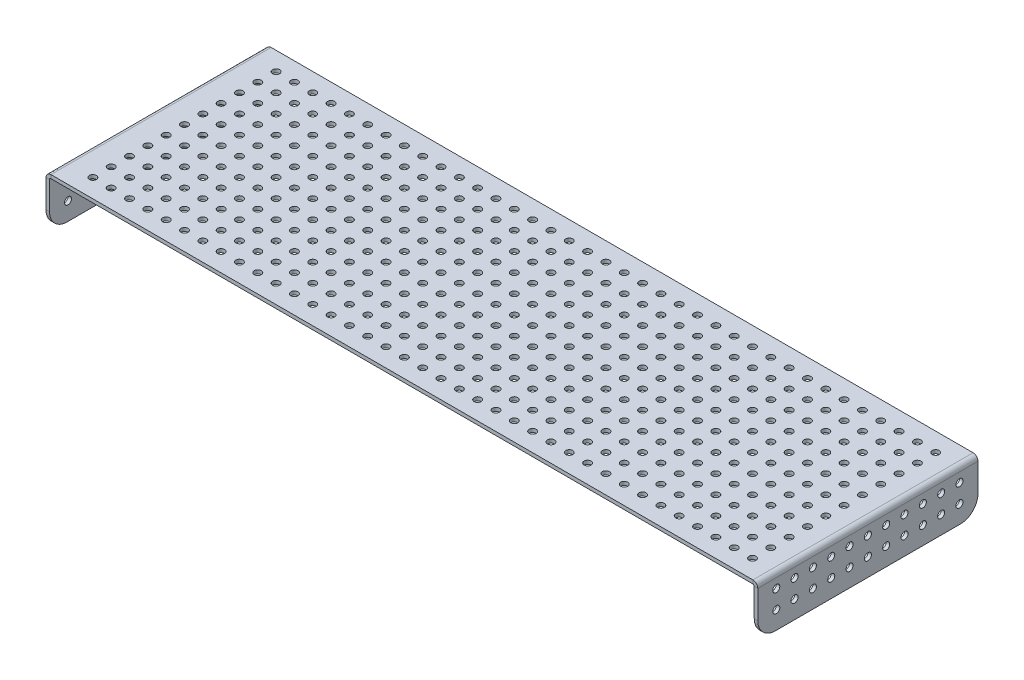
from build123d import *

# Parameters (mm, degrees)
BASE_FLANGE1_DEPTH = 119.0625
FILLET1_R          = 9.525
SKETCH8_R          = 1.905
CUT_EXTRUDE1_DEPTH = 1.905
SKETCH9_R          = 1.905
CUT_EXTRUDE2_DEPTH = 404.608442685


# Sheet-metal steps are written as plain solids
with BuildPart() as part:
    # Sketch2 → Base-Flange1 (new body)
    with BuildSketch(Plane.XY):
        with BuildLine():
            Line((-128.301113586, -25.4), (-128.301113586, -0.7366))
            ThreePointArc((-128.301113586, -0.7366), (-128.085368441, -0.215745145), (-127.564513586, 0))
            Line((-127.564513586, 0), (251.962286414, 0))
            ThreePointArc((251.962286414, 0), (252.483141269, -0.215745145), (252.698886414, -0.7366))
            Line((252.698886414, -0.7366), (252.698886414, -25.4))
            Line((252.698886414, -25.4), (254.603886414, -25.4))
            Line((254.603886414, -25.4), (254.603886414, -0.7366))
            ThreePointArc((254.603886414, -0.7366), (253.830179687, 1.131293273), (251.962286414, 1.905))
            Line((251.962286414, 1.905), (-127.564513586, 1.905))
            ThreePointArc((-127.564513586, 1.905), (-129.432406859, 1.131293273), (-130.206113586, -0.7366))
            Line((-130.206113586, -0.7366), (-130.206113586, -25.4))
            Line((-130.206113586, -25.4), (-128.301113586, -25.4))
        make_face()
    extrude(amount=-BASE_FLANGE1_DEPTH)

    # Fillet1
    fillet1_edges = [part.edges().sort_by_distance(p)[0] for p in [
        (253.651386414, -25.4, 0),
        (-129.253613586, -25.4, 0),
        (253.651386414, -25.4, -119.0625),
        (-129.253613586, -25.4, -119.0625),
    ]]
    fillet(fillet1_edges, radius=FILLET1_R)

    # Sketch8 → Cut-Extrude1 (cut)
    with BuildSketch(Plane(origin=(0, 1.905, 0), x_dir=(1, 0, 0), z_dir=(0, 1, 0))):
        with Locations(Location((-114.864513586, 10.00125, 0), (0, 0, 270))):
            Circle(SKETCH8_R)
        with Locations(Location((-104.958513586, 10.00125, 0), (0, 0, 270))):
            Circle(SKETCH8_R)
        with Locations(Location((-95.052513586, 10.00125, 0), (0, 0, 270))):
            Circle(SKETCH8_R)
        with Locations(Location((-85.146513586, 10.00125, 0), (0, 0, 270))):
            Circle(SKETCH8_R)
        with Locations(Location((-75.240513586, 10.00125, 0), (0, 0, 270))):
            Circle(SKETCH8_R)
        with Locations(Location((-65.334513586, 10.00125, 0), (0, 0, 270))):
            Circle(SKETCH8_R)
        with Locations(Location((-55.428513586, 10.00125, 0), (0, 0, 270))):
            Circle(SKETCH8_R)
        with Locations(Location((-45.522513586, 10.00125, 0), (0, 0, 270))):
            Circle(SKETCH8_R)
        with Locations(Location((-35.616513586, 10.00125, 0), (0, 0, 270))):
            Circle(SKETCH8_R)
        with Locations(Location((-25.710513586, 10.00125, 0), (0, 0, 270))):
            Circle(SKETCH8_R)
        with Locations(Location((-15.804513586, 10.00125, 0), (0, 0, 270))):
            Circle(SKETCH8_R)
        with Locations(Location((-5.898513586, 10.00125, 0), (0, 0, 270))):
            Circle(SKETCH8_R)
        with Locations(Location((4.007486414, 10.00125, 0), (0, 0, 270))):
            Circle(SKETCH8_R)
        with Locations(Location((13.913486414, 10.00125, 0), (0, 0, 270))):
            Circle(SKETCH8_R)
        with Locations(Location((23.819486414, 10.00125, 0), (0, 0, 270))):
            Circle(SKETCH8_R)
        with Locations(Location((33.725486414, 10.00125, 0), (0, 0, 270))):
            Circle(SKETCH8_R)
        with Locations(Location((43.631486414, 10.00125, 0), (0, 0, 270))):
            Circle(SKETCH8_R)
        with Locations(Location((53.537486414, 10.00125, 0), (0, 0, 270))):
            Circle(SKETCH8_R)
        with Locations(Location((63.443486414, 10.00125, 0), (0, 0, 270))):
            Circle(SKETCH8_R)
        with Locations(Location((73.349486414, 10.00125, 0), (0, 0, 270))):
            Circle(SKETCH8_R)
        with Locations(Location((83.255486414, 10.00125, 0), (0, 0, 270))):
            Circle(SKETCH8_R)
        with Locations(Location((93.161486414, 10.00125, 0), (0, 0, 270))):
            Circle(SKETCH8_R)
        with Locations(Location((103.067486414, 10.00125, 0), (0, 0, 270))):
            Circle(SKETCH8_R)
        with Locations(Location((112.973486414, 10.00125, 0), (0, 0, 270))):
            Circle(SKETCH8_R)
        with Locations(Location((122.879486414, 10.00125, 0), (0, 0, 270))):
            Circle(SKETCH8_R)
        with Locations(Location((132.785486414, 10.00125, 0), (0, 0, 270))):
            Circle(SKETCH8_R)
        with Locations(Location((142.691486414, 10.00125, 0), (0, 0, 270))):
            Circle(SKETCH8_R)
        with Locations(Location((152.597486414, 10.00125, 0), (0, 0, 270))):
            Circle(SKETCH8_R)
        with Locations(Location((162.503486414, 10.00125, 0), (0, 0, 270))):
            Circle(SKETCH8_R)
        with Locations(Location((172.409486414, 10.00125, 0), (0, 0, 270))):
            Circle(SKETCH8_R)
        with Locations(Location((182.315486414, 10.00125, 0), (0, 0, 270))):
            Circle(SKETCH8_R)
        with Locations(Location((192.221486414, 10.00125, 0), (0, 0, 270))):
            Circle(SKETCH8_R)
        with Locations(Location((202.127486414, 10.00125, 0), (0, 0, 270))):
            Circle(SKETCH8_R)
        with Locations(Location((212.033486414, 10.00125, 0), (0, 0, 270))):
            Circle(SKETCH8_R)
        with Locations(Location((221.939486414, 10.00125, 0), (0, 0, 270))):
            Circle(SKETCH8_R)
        with Locations(Location((231.845486414, 10.00125, 0), (0, 0, 270))):
            Circle(SKETCH8_R)
        with Locations(Location((241.751486414, 10.00125, 0), (0, 0, 270))):
            Circle(SKETCH8_R)
        with Locations(Location((-104.958513586, 19.90725, 0), (0, 0, 270))):
            Circle(SKETCH8_R)
        with Locations(Location((-95.052513586, 19.90725, 0), (0, 0, 270))):
            Circle(SKETCH8_R)
        with Locations(Location((-85.146513586, 19.90725, 0), (0, 0, 270))):
            Circle(SKETCH8_R)
        with Locations(Location((-75.240513586, 19.90725, 0), (0, 0, 270))):
            Circle(SKETCH8_R)
        with Locations(Location((-65.334513586, 19.90725, 0), (0, 0, 270))):
            Circle(SKETCH8_R)
        with Locations(Location((-55.428513586, 19.90725, 0), (0, 0, 270))):
            Circle(SKETCH8_R)
        with Locations(Location((-45.522513586, 19.90725, 0), (0, 0, 270))):
            Circle(SKETCH8_R)
        with Locations(Location((-35.616513586, 19.90725, 0), (0, 0, 270))):
            Circle(SKETCH8_R)
        with Locations(Location((-25.710513586, 19.90725, 0), (0, 0, 270))):
            Circle(SKETCH8_R)
        with Locations(Location((-15.804513586, 19.90725, 0), (0, 0, 270))):
            Circle(SKETCH8_R)
        with Locations(Location((-5.898513586, 19.90725, 0), (0, 0, 270))):
            Circle(SKETCH8_R)
        with Locations(Location((4.007486414, 19.90725, 0), (0, 0, 270))):
            Circle(SKETCH8_R)
        with Locations(Location((13.913486414, 19.90725, 0), (0, 0, 270))):
            Circle(SKETCH8_R)
        with Locations(Location((23.819486414, 19.90725, 0), (0, 0, 270))):
            Circle(SKETCH8_R)
        with Locations(Location((33.725486414, 19.90725, 0), (0, 0, 270))):
            Circle(SKETCH8_R)
        with Locations(Location((43.631486414, 19.90725, 0), (0, 0, 270))):
            Circle(SKETCH8_R)
        with Locations(Location((53.537486414, 19.90725, 0), (0, 0, 270))):
            Circle(SKETCH8_R)
        with Locations(Location((63.443486414, 19.90725, 0), (0, 0, 270))):
            Circle(SKETCH8_R)
        with Locations(Location((73.349486414, 19.90725, 0), (0, 0, 270))):
            Circle(SKETCH8_R)
        with Locations(Location((83.255486414, 19.90725, 0), (0, 0, 270))):
            Circle(SKETCH8_R)
        with Locations(Location((93.161486414, 19.90725, 0), (0, 0, 270))):
            Circle(SKETCH8_R)
        with Locations(Location((103.067486414, 19.90725, 0), (0, 0, 270))):
            Circle(SKETCH8_R)
        with Locations(Location((112.973486414, 19.90725, 0), (0, 0, 270))):
            Circle(SKETCH8_R)
        with Locations(Location((122.879486414, 19.90725, 0), (0, 0, 270))):
            Circle(SKETCH8_R)
        with Locations(Location((132.785486414, 19.90725, 0), (0, 0, 270))):
            Circle(SKETCH8_R)
        with Locations(Location((142.691486414, 19.90725, 0), (0, 0, 270))):
            Circle(SKETCH8_R)
        with Locations(Location((152.597486414, 19.90725, 0), (0, 0, 270))):
            Circle(SKETCH8_R)
        with Locations(Location((162.503486414, 19.90725, 0), (0, 0, 270))):
            Circle(SKETCH8_R)
        with Locations(Location((172.409486414, 19.90725, 0), (0, 0, 270))):
            Circle(SKETCH8_R)
        with Locations(Location((182.315486414, 19.90725, 0), (0, 0, 270))):
            Circle(SKETCH8_R)
        with Locations(Location((192.221486414, 19.90725, 0), (0, 0, 270))):
            Circle(SKETCH8_R)
        with Locations(Location((202.127486414, 19.90725, 0), (0, 0, 270))):
            Circle(SKETCH8_R)
        with Locations(Location((212.033486414, 19.90725, 0), (0, 0, 270))):
            Circle(SKETCH8_R)
        with Locations(Location((221.939486414, 19.90725, 0), (0, 0, 270))):
            Circle(SKETCH8_R)
        with Locations(Location((231.845486414, 19.90725, 0), (0, 0, 270))):
            Circle(SKETCH8_R)
        with Locations(Location((241.751486414, 19.90725, 0), (0, 0, 270))):
            Circle(SKETCH8_R)
        with Locations(Location((-104.958513586, 29.81325, 0), (0, 0, 270))):
            Circle(SKETCH8_R)
        with Locations(Location((-95.052513586, 29.81325, 0), (0, 0, 270))):
            Circle(SKETCH8_R)
        with Locations(Location((-85.146513586, 29.81325, 0), (0, 0, 270))):
            Circle(SKETCH8_R)
        with Locations(Location((-75.240513586, 29.81325, 0), (0, 0, 270))):
            Circle(SKETCH8_R)
        with Locations(Location((-65.334513586, 29.81325, 0), (0, 0, 270))):
            Circle(SKETCH8_R)
        with Locations(Location((-55.428513586, 29.81325, 0), (0, 0, 270))):
            Circle(SKETCH8_R)
        with Locations(Location((-45.522513586, 29.81325, 0), (0, 0, 270))):
            Circle(SKETCH8_R)
        with Locations(Location((-35.616513586, 29.81325, 0), (0, 0, 270))):
            Circle(SKETCH8_R)
        with Locations(Location((-25.710513586, 29.81325, 0), (0, 0, 270))):
            Circle(SKETCH8_R)
        with Locations(Location((-15.804513586, 29.81325, 0), (0, 0, 270))):
            Circle(SKETCH8_R)
        with Locations(Location((-5.898513586, 29.81325, 0), (0, 0, 270))):
            Circle(SKETCH8_R)
        with Locations(Location((4.007486414, 29.81325, 0), (0, 0, 270))):
            Circle(SKETCH8_R)
        with Locations(Location((13.913486414, 29.81325, 0), (0, 0, 270))):
            Circle(SKETCH8_R)
        with Locations(Location((23.819486414, 29.81325, 0), (0, 0, 270))):
            Circle(SKETCH8_R)
        with Locations(Location((33.725486414, 29.81325, 0), (0, 0, 270))):
            Circle(SKETCH8_R)
        with Locations(Location((43.631486414, 29.81325, 0), (0, 0, 270))):
            Circle(SKETCH8_R)
        with Locations(Location((53.537486414, 29.81325, 0), (0, 0, 270))):
            Circle(SKETCH8_R)
        with Locations(Location((63.443486414, 29.81325, 0), (0, 0, 270))):
            Circle(SKETCH8_R)
        with Locations(Location((73.349486414, 29.81325, 0), (0, 0, 270))):
            Circle(SKETCH8_R)
        with Locations(Location((83.255486414, 29.81325, 0), (0, 0, 270))):
            Circle(SKETCH8_R)
        with Locations(Location((93.161486414, 29.81325, 0), (0, 0, 270))):
            Circle(SKETCH8_R)
        with Locations(Location((103.067486414, 29.81325, 0), (0, 0, 270))):
            Circle(SKETCH8_R)
        with Locations(Location((112.973486414, 29.81325, 0), (0, 0, 270))):
            Circle(SKETCH8_R)
        with Locations(Location((122.879486414, 29.81325, 0), (0, 0, 270))):
            Circle(SKETCH8_R)
        with Locations(Location((132.785486414, 29.81325, 0), (0, 0, 270))):
            Circle(SKETCH8_R)
        with Locations(Location((142.691486414, 29.81325, 0), (0, 0, 270))):
            Circle(SKETCH8_R)
        with Locations(Location((152.597486414, 29.81325, 0), (0, 0, 270))):
            Circle(SKETCH8_R)
        with Locations(Location((162.503486414, 29.81325, 0), (0, 0, 270))):
            Circle(SKETCH8_R)
        with Locations(Location((172.409486414, 29.81325, 0), (0, 0, 270))):
            Circle(SKETCH8_R)
        with Locations(Location((182.315486414, 29.81325, 0), (0, 0, 270))):
            Circle(SKETCH8_R)
        with Locations(Location((192.221486414, 29.81325, 0), (0, 0, 270))):
            Circle(SKETCH8_R)
        with Locations(Location((202.127486414, 29.81325, 0), (0, 0, 270))):
            Circle(SKETCH8_R)
        with Locations(Location((212.033486414, 29.81325, 0), (0, 0, 270))):
            Circle(SKETCH8_R)
        with Locations(Location((221.939486414, 29.81325, 0), (0, 0, 270))):
            Circle(SKETCH8_R)
        with Locations(Location((231.845486414, 29.81325, 0), (0, 0, 270))):
            Circle(SKETCH8_R)
        with Locations(Location((241.751486414, 29.81325, 0), (0, 0, 270))):
            Circle(SKETCH8_R)
        with Locations(Location((-104.958513586, 39.71925, 0), (0, 0, 270))):
            Circle(SKETCH8_R)
        with Locations(Location((-95.052513586, 39.71925, 0), (0, 0, 270))):
            Circle(SKETCH8_R)
        with Locations(Location((-85.146513586, 39.71925, 0), (0, 0, 270))):
            Circle(SKETCH8_R)
        with Locations(Location((-75.240513586, 39.71925, 0), (0, 0, 270))):
            Circle(SKETCH8_R)
        with Locations(Location((-65.334513586, 39.71925, 0), (0, 0, 270))):
            Circle(SKETCH8_R)
        with Locations(Location((-55.428513586, 39.71925, 0), (0, 0, 270))):
            Circle(SKETCH8_R)
        with Locations(Location((-45.522513586, 39.71925, 0), (0, 0, 270))):
            Circle(SKETCH8_R)
        with Locations(Location((-35.616513586, 39.71925, 0), (0, 0, 270))):
            Circle(SKETCH8_R)
        with Locations(Location((-25.710513586, 39.71925, 0), (0, 0, 270))):
            Circle(SKETCH8_R)
        with Locations(Location((-15.804513586, 39.71925, 0), (0, 0, 270))):
            Circle(SKETCH8_R)
        with Locations(Location((-5.898513586, 39.71925, 0), (0, 0, 270))):
            Circle(SKETCH8_R)
        with Locations(Location((4.007486414, 39.71925, 0), (0, 0, 270))):
            Circle(SKETCH8_R)
        with Locations(Location((13.913486414, 39.71925, 0), (0, 0, 270))):
            Circle(SKETCH8_R)
        with Locations(Location((23.819486414, 39.71925, 0), (0, 0, 270))):
            Circle(SKETCH8_R)
        with Locations(Location((33.725486414, 39.71925, 0), (0, 0, 270))):
            Circle(SKETCH8_R)
        with Locations(Location((43.631486414, 39.71925, 0), (0, 0, 270))):
            Circle(SKETCH8_R)
        with Locations(Location((53.537486414, 39.71925, 0), (0, 0, 270))):
            Circle(SKETCH8_R)
        with Locations(Location((63.443486414, 39.71925, 0), (0, 0, 270))):
            Circle(SKETCH8_R)
        with Locations(Location((73.349486414, 39.71925, 0), (0, 0, 270))):
            Circle(SKETCH8_R)
        with Locations(Location((83.255486414, 39.71925, 0), (0, 0, 270))):
            Circle(SKETCH8_R)
        with Locations(Location((93.161486414, 39.71925, 0), (0, 0, 270))):
            Circle(SKETCH8_R)
        with Locations(Location((103.067486414, 39.71925, 0), (0, 0, 270))):
            Circle(SKETCH8_R)
        with Locations(Location((112.973486414, 39.71925, 0), (0, 0, 270))):
            Circle(SKETCH8_R)
        with Locations(Location((122.879486414, 39.71925, 0), (0, 0, 270))):
            Circle(SKETCH8_R)
        with Locations(Location((132.785486414, 39.71925, 0), (0, 0, 270))):
            Circle(SKETCH8_R)
        with Locations(Location((142.691486414, 39.71925, 0), (0, 0, 270))):
            Circle(SKETCH8_R)
        with Locations(Location((152.597486414, 39.71925, 0), (0, 0, 270))):
            Circle(SKETCH8_R)
        with Locations(Location((162.503486414, 39.71925, 0), (0, 0, 270))):
            Circle(SKETCH8_R)
        with Locations(Location((172.409486414, 39.71925, 0), (0, 0, 270))):
            Circle(SKETCH8_R)
        with Locations(Location((182.315486414, 39.71925, 0), (0, 0, 270))):
            Circle(SKETCH8_R)
        with Locations(Location((192.221486414, 39.71925, 0), (0, 0, 270))):
            Circle(SKETCH8_R)
        with Locations(Location((202.127486414, 39.71925, 0), (0, 0, 270))):
            Circle(SKETCH8_R)
        with Locations(Location((212.033486414, 39.71925, 0), (0, 0, 270))):
            Circle(SKETCH8_R)
        with Locations(Location((221.939486414, 39.71925, 0), (0, 0, 270))):
            Circle(SKETCH8_R)
        with Locations(Location((231.845486414, 39.71925, 0), (0, 0, 270))):
            Circle(SKETCH8_R)
        with Locations(Location((241.751486414, 39.71925, 0), (0, 0, 270))):
            Circle(SKETCH8_R)
        with Locations(Location((-104.958513586, 49.62525, 0), (0, 0, 270))):
            Circle(SKETCH8_R)
        with Locations(Location((-95.052513586, 49.62525, 0), (0, 0, 270))):
            Circle(SKETCH8_R)
        with Locations(Location((-85.146513586, 49.62525, 0), (0, 0, 270))):
            Circle(SKETCH8_R)
        with Locations(Location((-75.240513586, 49.62525, 0), (0, 0, 270))):
            Circle(SKETCH8_R)
        with Locations(Location((-65.334513586, 49.62525, 0), (0, 0, 270))):
            Circle(SKETCH8_R)
        with Locations(Location((-55.428513586, 49.62525, 0), (0, 0, 270))):
            Circle(SKETCH8_R)
        with Locations(Location((-45.522513586, 49.62525, 0), (0, 0, 270))):
            Circle(SKETCH8_R)
        with Locations(Location((-35.616513586, 49.62525, 0), (0, 0, 270))):
            Circle(SKETCH8_R)
        with Locations(Location((-25.710513586, 49.62525, 0), (0, 0, 270))):
            Circle(SKETCH8_R)
        with Locations(Location((-15.804513586, 49.62525, 0), (0, 0, 270))):
            Circle(SKETCH8_R)
        with Locations(Location((-5.898513586, 49.62525, 0), (0, 0, 270))):
            Circle(SKETCH8_R)
        with Locations(Location((4.007486414, 49.62525, 0), (0, 0, 270))):
            Circle(SKETCH8_R)
        with Locations(Location((13.913486414, 49.62525, 0), (0, 0, 270))):
            Circle(SKETCH8_R)
        with Locations(Location((23.819486414, 49.62525, 0), (0, 0, 270))):
            Circle(SKETCH8_R)
        with Locations(Location((33.725486414, 49.62525, 0), (0, 0, 270))):
            Circle(SKETCH8_R)
        with Locations(Location((43.631486414, 49.62525, 0), (0, 0, 270))):
            Circle(SKETCH8_R)
        with Locations(Location((53.537486414, 49.62525, 0), (0, 0, 270))):
            Circle(SKETCH8_R)
        with Locations(Location((63.443486414, 49.62525, 0), (0, 0, 270))):
            Circle(SKETCH8_R)
        with Locations(Location((73.349486414, 49.62525, 0), (0, 0, 270))):
            Circle(SKETCH8_R)
        with Locations(Location((83.255486414, 49.62525, 0), (0, 0, 270))):
            Circle(SKETCH8_R)
        with Locations(Location((93.161486414, 49.62525, 0), (0, 0, 270))):
            Circle(SKETCH8_R)
        with Locations(Location((103.067486414, 49.62525, 0), (0, 0, 270))):
            Circle(SKETCH8_R)
        with Locations(Location((112.973486414, 49.62525, 0), (0, 0, 270))):
            Circle(SKETCH8_R)
        with Locations(Location((122.879486414, 49.62525, 0), (0, 0, 270))):
            Circle(SKETCH8_R)
        with Locations(Location((132.785486414, 49.62525, 0), (0, 0, 270))):
            Circle(SKETCH8_R)
        with Locations(Location((142.691486414, 49.62525, 0), (0, 0, 270))):
            Circle(SKETCH8_R)
        with Locations(Location((152.597486414, 49.62525, 0), (0, 0, 270))):
            Circle(SKETCH8_R)
        with Locations(Location((162.503486414, 49.62525, 0), (0, 0, 270))):
            Circle(SKETCH8_R)
        with Locations(Location((172.409486414, 49.62525, 0), (0, 0, 270))):
            Circle(SKETCH8_R)
        with Locations(Location((182.315486414, 49.62525, 0), (0, 0, 270))):
            Circle(SKETCH8_R)
        with Locations(Location((192.221486414, 49.62525, 0), (0, 0, 270))):
            Circle(SKETCH8_R)
        with Locations(Location((202.127486414, 49.62525, 0), (0, 0, 270))):
            Circle(SKETCH8_R)
        with Locations(Location((212.033486414, 49.62525, 0), (0, 0, 270))):
            Circle(SKETCH8_R)
        with Locations(Location((221.939486414, 49.62525, 0), (0, 0, 270))):
            Circle(SKETCH8_R)
        with Locations(Location((231.845486414, 49.62525, 0), (0, 0, 270))):
            Circle(SKETCH8_R)
        with Locations(Location((241.751486414, 49.62525, 0), (0, 0, 270))):
            Circle(SKETCH8_R)
        with Locations(Location((-104.958513586, 59.53125, 0), (0, 0, 270))):
            Circle(SKETCH8_R)
        with Locations(Location((-95.052513586, 59.53125, 0), (0, 0, 270))):
            Circle(SKETCH8_R)
        with Locations(Location((-85.146513586, 59.53125, 0), (0, 0, 270))):
            Circle(SKETCH8_R)
        with Locations(Location((-75.240513586, 59.53125, 0), (0, 0, 270))):
            Circle(SKETCH8_R)
        with Locations(Location((-65.334513586, 59.53125, 0), (0, 0, 270))):
            Circle(SKETCH8_R)
        with Locations(Location((-55.428513586, 59.53125, 0), (0, 0, 270))):
            Circle(SKETCH8_R)
        with Locations(Location((-45.522513586, 59.53125, 0), (0, 0, 270))):
            Circle(SKETCH8_R)
        with Locations(Location((-35.616513586, 59.53125, 0), (0, 0, 270))):
            Circle(SKETCH8_R)
        with Locations(Location((-25.710513586, 59.53125, 0), (0, 0, 270))):
            Circle(SKETCH8_R)
        with Locations(Location((-15.804513586, 59.53125, 0), (0, 0, 270))):
            Circle(SKETCH8_R)
        with Locations(Location((-5.898513586, 59.53125, 0), (0, 0, 270))):
            Circle(SKETCH8_R)
        with Locations(Location((4.007486414, 59.53125, 0), (0, 0, 270))):
            Circle(SKETCH8_R)
        with Locations(Location((13.913486414, 59.53125, 0), (0, 0, 270))):
            Circle(SKETCH8_R)
        with Locations(Location((23.819486414, 59.53125, 0), (0, 0, 270))):
            Circle(SKETCH8_R)
        with Locations(Location((33.725486414, 59.53125, 0), (0, 0, 270))):
            Circle(SKETCH8_R)
        with Locations(Location((43.631486414, 59.53125, 0), (0, 0, 270))):
            Circle(SKETCH8_R)
        with Locations(Location((53.537486414, 59.53125, 0), (0, 0, 270))):
            Circle(SKETCH8_R)
        with Locations(Location((63.443486414, 59.53125, 0), (0, 0, 270))):
            Circle(SKETCH8_R)
        with Locations(Location((73.349486414, 59.53125, 0), (0, 0, 270))):
            Circle(SKETCH8_R)
        with Locations(Location((83.255486414, 59.53125, 0), (0, 0, 270))):
            Circle(SKETCH8_R)
        with Locations(Location((93.161486414, 59.53125, 0), (0, 0, 270))):
            Circle(SKETCH8_R)
        with Locations(Location((103.067486414, 59.53125, 0), (0, 0, 270))):
            Circle(SKETCH8_R)
        with Locations(Location((112.973486414, 59.53125, 0), (0, 0, 270))):
            Circle(SKETCH8_R)
        with Locations(Location((122.879486414, 59.53125, 0), (0, 0, 270))):
            Circle(SKETCH8_R)
        with Locations(Location((132.785486414, 59.53125, 0), (0, 0, 270))):
            Circle(SKETCH8_R)
        with Locations(Location((142.691486414, 59.53125, 0), (0, 0, 270))):
            Circle(SKETCH8_R)
        with Locations(Location((152.597486414, 59.53125, 0), (0, 0, 270))):
            Circle(SKETCH8_R)
        with Locations(Location((162.503486414, 59.53125, 0), (0, 0, 270))):
            Circle(SKETCH8_R)
        with Locations(Location((172.409486414, 59.53125, 0), (0, 0, 270))):
            Circle(SKETCH8_R)
        with Locations(Location((182.315486414, 59.53125, 0), (0, 0, 270))):
            Circle(SKETCH8_R)
        with Locations(Location((192.221486414, 59.53125, 0), (0, 0, 270))):
            Circle(SKETCH8_R)
        with Locations(Location((202.127486414, 59.53125, 0), (0, 0, 270))):
            Circle(SKETCH8_R)
        with Locations(Location((212.033486414, 59.53125, 0), (0, 0, 270))):
            Circle(SKETCH8_R)
        with Locations(Location((221.939486414, 59.53125, 0), (0, 0, 270))):
            Circle(SKETCH8_R)
        with Locations(Location((231.845486414, 59.53125, 0), (0, 0, 270))):
            Circle(SKETCH8_R)
        with Locations(Location((241.751486414, 59.53125, 0), (0, 0, 270))):
            Circle(SKETCH8_R)
        with Locations(Location((-104.958513586, 69.43725, 0), (0, 0, 270))):
            Circle(SKETCH8_R)
        with Locations(Location((-95.052513586, 69.43725, 0), (0, 0, 270))):
            Circle(SKETCH8_R)
        with Locations(Location((-85.146513586, 69.43725, 0), (0, 0, 270))):
            Circle(SKETCH8_R)
        with Locations(Location((-75.240513586, 69.43725, 0), (0, 0, 270))):
            Circle(SKETCH8_R)
        with Locations(Location((-65.334513586, 69.43725, 0), (0, 0, 270))):
            Circle(SKETCH8_R)
        with Locations(Location((-55.428513586, 69.43725, 0), (0, 0, 270))):
            Circle(SKETCH8_R)
        with Locations(Location((-45.522513586, 69.43725, 0), (0, 0, 270))):
            Circle(SKETCH8_R)
        with Locations(Location((-35.616513586, 69.43725, 0), (0, 0, 270))):
            Circle(SKETCH8_R)
        with Locations(Location((-25.710513586, 69.43725, 0), (0, 0, 270))):
            Circle(SKETCH8_R)
        with Locations(Location((-15.804513586, 69.43725, 0), (0, 0, 270))):
            Circle(SKETCH8_R)
        with Locations(Location((-5.898513586, 69.43725, 0), (0, 0, 270))):
            Circle(SKETCH8_R)
        with Locations(Location((4.007486414, 69.43725, 0), (0, 0, 270))):
            Circle(SKETCH8_R)
        with Locations(Location((13.913486414, 69.43725, 0), (0, 0, 270))):
            Circle(SKETCH8_R)
        with Locations(Location((23.819486414, 69.43725, 0), (0, 0, 270))):
            Circle(SKETCH8_R)
        with Locations(Location((33.725486414, 69.43725, 0), (0, 0, 270))):
            Circle(SKETCH8_R)
        with Locations(Location((43.631486414, 69.43725, 0), (0, 0, 270))):
            Circle(SKETCH8_R)
        with Locations(Location((53.537486414, 69.43725, 0), (0, 0, 270))):
            Circle(SKETCH8_R)
        with Locations(Location((63.443486414, 69.43725, 0), (0, 0, 270))):
            Circle(SKETCH8_R)
        with Locations(Location((73.349486414, 69.43725, 0), (0, 0, 270))):
            Circle(SKETCH8_R)
        with Locations(Location((83.255486414, 69.43725, 0), (0, 0, 270))):
            Circle(SKETCH8_R)
        with Locations(Location((93.161486414, 69.43725, 0), (0, 0, 270))):
            Circle(SKETCH8_R)
        with Locations(Location((103.067486414, 69.43725, 0), (0, 0, 270))):
            Circle(SKETCH8_R)
        with Locations(Location((112.973486414, 69.43725, 0), (0, 0, 270))):
            Circle(SKETCH8_R)
        with Locations(Location((122.879486414, 69.43725, 0), (0, 0, 270))):
            Circle(SKETCH8_R)
        with Locations(Location((132.785486414, 69.43725, 0), (0, 0, 270))):
            Circle(SKETCH8_R)
        with Locations(Location((142.691486414, 69.43725, 0), (0, 0, 270))):
            Circle(SKETCH8_R)
        with Locations(Location((152.597486414, 69.43725, 0), (0, 0, 270))):
            Circle(SKETCH8_R)
        with Locations(Location((162.503486414, 69.43725, 0), (0, 0, 270))):
            Circle(SKETCH8_R)
        with Locations(Location((172.409486414, 69.43725, 0), (0, 0, 270))):
            Circle(SKETCH8_R)
        with Locations(Location((182.315486414, 69.43725, 0), (0, 0, 270))):
            Circle(SKETCH8_R)
        with Locations(Location((192.221486414, 69.43725, 0), (0, 0, 270))):
            Circle(SKETCH8_R)
        with Locations(Location((202.127486414, 69.43725, 0), (0, 0, 270))):
            Circle(SKETCH8_R)
        with Locations(Location((212.033486414, 69.43725, 0), (0, 0, 270))):
            Circle(SKETCH8_R)
        with Locations(Location((221.939486414, 69.43725, 0), (0, 0, 270))):
            Circle(SKETCH8_R)
        with Locations(Location((231.845486414, 69.43725, 0), (0, 0, 270))):
            Circle(SKETCH8_R)
        with Locations(Location((241.751486414, 69.43725, 0), (0, 0, 270))):
            Circle(SKETCH8_R)
        with Locations(Location((-104.958513586, 79.34325, 0), (0, 0, 270))):
            Circle(SKETCH8_R)
        with Locations(Location((-95.052513586, 79.34325, 0), (0, 0, 270))):
            Circle(SKETCH8_R)
        with Locations(Location((-85.146513586, 79.34325, 0), (0, 0, 270))):
            Circle(SKETCH8_R)
        with Locations(Location((-75.240513586, 79.34325, 0), (0, 0, 270))):
            Circle(SKETCH8_R)
        with Locations(Location((-65.334513586, 79.34325, 0), (0, 0, 270))):
            Circle(SKETCH8_R)
        with Locations(Location((-55.428513586, 79.34325, 0), (0, 0, 270))):
            Circle(SKETCH8_R)
        with Locations(Location((-45.522513586, 79.34325, 0), (0, 0, 270))):
            Circle(SKETCH8_R)
        with Locations(Location((-35.616513586, 79.34325, 0), (0, 0, 270))):
            Circle(SKETCH8_R)
        with Locations(Location((-25.710513586, 79.34325, 0), (0, 0, 270))):
            Circle(SKETCH8_R)
        with Locations(Location((-15.804513586, 79.34325, 0), (0, 0, 270))):
            Circle(SKETCH8_R)
        with Locations(Location((-5.898513586, 79.34325, 0), (0, 0, 270))):
            Circle(SKETCH8_R)
        with Locations(Location((4.007486414, 79.34325, 0), (0, 0, 270))):
            Circle(SKETCH8_R)
        with Locations(Location((13.913486414, 79.34325, 0), (0, 0, 270))):
            Circle(SKETCH8_R)
        with Locations(Location((23.819486414, 79.34325, 0), (0, 0, 270))):
            Circle(SKETCH8_R)
        with Locations(Location((33.725486414, 79.34325, 0), (0, 0, 270))):
            Circle(SKETCH8_R)
        with Locations(Location((43.631486414, 79.34325, 0), (0, 0, 270))):
            Circle(SKETCH8_R)
        with Locations(Location((53.537486414, 79.34325, 0), (0, 0, 270))):
            Circle(SKETCH8_R)
        with Locations(Location((63.443486414, 79.34325, 0), (0, 0, 270))):
            Circle(SKETCH8_R)
        with Locations(Location((73.349486414, 79.34325, 0), (0, 0, 270))):
            Circle(SKETCH8_R)
        with Locations(Location((83.255486414, 79.34325, 0), (0, 0, 270))):
            Circle(SKETCH8_R)
        with Locations(Location((93.161486414, 79.34325, 0), (0, 0, 270))):
            Circle(SKETCH8_R)
        with Locations(Location((103.067486414, 79.34325, 0), (0, 0, 270))):
            Circle(SKETCH8_R)
        with Locations(Location((112.973486414, 79.34325, 0), (0, 0, 270))):
            Circle(SKETCH8_R)
        with Locations(Location((122.879486414, 79.34325, 0), (0, 0, 270))):
            Circle(SKETCH8_R)
        with Locations(Location((132.785486414, 79.34325, 0), (0, 0, 270))):
            Circle(SKETCH8_R)
        with Locations(Location((142.691486414, 79.34325, 0), (0, 0, 270))):
            Circle(SKETCH8_R)
        with Locations(Location((152.597486414, 79.34325, 0), (0, 0, 270))):
            Circle(SKETCH8_R)
        with Locations(Location((162.503486414, 79.34325, 0), (0, 0, 270))):
            Circle(SKETCH8_R)
        with Locations(Location((172.409486414, 79.34325, 0), (0, 0, 270))):
            Circle(SKETCH8_R)
        with Locations(Location((182.315486414, 79.34325, 0), (0, 0, 270))):
            Circle(SKETCH8_R)
        with Locations(Location((192.221486414, 79.34325, 0), (0, 0, 270))):
            Circle(SKETCH8_R)
        with Locations(Location((202.127486414, 79.34325, 0), (0, 0, 270))):
            Circle(SKETCH8_R)
        with Locations(Location((212.033486414, 79.34325, 0), (0, 0, 270))):
            Circle(SKETCH8_R)
        with Locations(Location((221.939486414, 79.34325, 0), (0, 0, 270))):
            Circle(SKETCH8_R)
        with Locations(Location((231.845486414, 79.34325, 0), (0, 0, 270))):
            Circle(SKETCH8_R)
        with Locations(Location((241.751486414, 79.34325, 0), (0, 0, 270))):
            Circle(SKETCH8_R)
        with Locations(Location((-104.958513586, 89.24925, 0), (0, 0, 270))):
            Circle(SKETCH8_R)
        with Locations(Location((-95.052513586, 89.24925, 0), (0, 0, 270))):
            Circle(SKETCH8_R)
        with Locations(Location((-85.146513586, 89.24925, 0), (0, 0, 270))):
            Circle(SKETCH8_R)
        with Locations(Location((-75.240513586, 89.24925, 0), (0, 0, 270))):
            Circle(SKETCH8_R)
        with Locations(Location((-65.334513586, 89.24925, 0), (0, 0, 270))):
            Circle(SKETCH8_R)
        with Locations(Location((-55.428513586, 89.24925, 0), (0, 0, 270))):
            Circle(SKETCH8_R)
        with Locations(Location((-45.522513586, 89.24925, 0), (0, 0, 270))):
            Circle(SKETCH8_R)
        with Locations(Location((-35.616513586, 89.24925, 0), (0, 0, 270))):
            Circle(SKETCH8_R)
        with Locations(Location((-25.710513586, 89.24925, 0), (0, 0, 270))):
            Circle(SKETCH8_R)
        with Locations(Location((-15.804513586, 89.24925, 0), (0, 0, 270))):
            Circle(SKETCH8_R)
        with Locations(Location((-5.898513586, 89.24925, 0), (0, 0, 270))):
            Circle(SKETCH8_R)
        with Locations(Location((4.007486414, 89.24925, 0), (0, 0, 270))):
            Circle(SKETCH8_R)
        with Locations(Location((13.913486414, 89.24925, 0), (0, 0, 270))):
            Circle(SKETCH8_R)
        with Locations(Location((23.819486414, 89.24925, 0), (0, 0, 270))):
            Circle(SKETCH8_R)
        with Locations(Location((33.725486414, 89.24925, 0), (0, 0, 270))):
            Circle(SKETCH8_R)
        with Locations(Location((43.631486414, 89.24925, 0), (0, 0, 270))):
            Circle(SKETCH8_R)
        with Locations(Location((53.537486414, 89.24925, 0), (0, 0, 270))):
            Circle(SKETCH8_R)
        with Locations(Location((63.443486414, 89.24925, 0), (0, 0, 270))):
            Circle(SKETCH8_R)
        with Locations(Location((73.349486414, 89.24925, 0), (0, 0, 270))):
            Circle(SKETCH8_R)
        with Locations(Location((83.255486414, 89.24925, 0), (0, 0, 270))):
            Circle(SKETCH8_R)
        with Locations(Location((93.161486414, 89.24925, 0), (0, 0, 270))):
            Circle(SKETCH8_R)
        with Locations(Location((103.067486414, 89.24925, 0), (0, 0, 270))):
            Circle(SKETCH8_R)
        with Locations(Location((112.973486414, 89.24925, 0), (0, 0, 270))):
            Circle(SKETCH8_R)
        with Locations(Location((122.879486414, 89.24925, 0), (0, 0, 270))):
            Circle(SKETCH8_R)
        with Locations(Location((132.785486414, 89.24925, 0), (0, 0, 270))):
            Circle(SKETCH8_R)
        with Locations(Location((142.691486414, 89.24925, 0), (0, 0, 270))):
            Circle(SKETCH8_R)
        with Locations(Location((152.597486414, 89.24925, 0), (0, 0, 270))):
            Circle(SKETCH8_R)
        with Locations(Location((162.503486414, 89.24925, 0), (0, 0, 270))):
            Circle(SKETCH8_R)
        with Locations(Location((172.409486414, 89.24925, 0), (0, 0, 270))):
            Circle(SKETCH8_R)
        with Locations(Location((182.315486414, 89.24925, 0), (0, 0, 270))):
            Circle(SKETCH8_R)
        with Locations(Location((192.221486414, 89.24925, 0), (0, 0, 270))):
            Circle(SKETCH8_R)
        with Locations(Location((202.127486414, 89.24925, 0), (0, 0, 270))):
            Circle(SKETCH8_R)
        with Locations(Location((212.033486414, 89.24925, 0), (0, 0, 270))):
            Circle(SKETCH8_R)
        with Locations(Location((221.939486414, 89.24925, 0), (0, 0, 270))):
            Circle(SKETCH8_R)
        with Locations(Location((231.845486414, 89.24925, 0), (0, 0, 270))):
            Circle(SKETCH8_R)
        with Locations(Location((241.751486414, 89.24925, 0), (0, 0, 270))):
            Circle(SKETCH8_R)
        with Locations(Location((-104.958513586, 99.15525, 0), (0, 0, 270))):
            Circle(SKETCH8_R)
        with Locations(Location((-95.052513586, 99.15525, 0), (0, 0, 270))):
            Circle(SKETCH8_R)
        with Locations(Location((-85.146513586, 99.15525, 0), (0, 0, 270))):
            Circle(SKETCH8_R)
        with Locations(Location((-75.240513586, 99.15525, 0), (0, 0, 270))):
            Circle(SKETCH8_R)
        with Locations(Location((-65.334513586, 99.15525, 0), (0, 0, 270))):
            Circle(SKETCH8_R)
        with Locations(Location((-55.428513586, 99.15525, 0), (0, 0, 270))):
            Circle(SKETCH8_R)
        with Locations(Location((-45.522513586, 99.15525, 0), (0, 0, 270))):
            Circle(SKETCH8_R)
        with Locations(Location((-35.616513586, 99.15525, 0), (0, 0, 270))):
            Circle(SKETCH8_R)
        with Locations(Location((-25.710513586, 99.15525, 0), (0, 0, 270))):
            Circle(SKETCH8_R)
        with Locations(Location((-15.804513586, 99.15525, 0), (0, 0, 270))):
            Circle(SKETCH8_R)
        with Locations(Location((-5.898513586, 99.15525, 0), (0, 0, 270))):
            Circle(SKETCH8_R)
        with Locations(Location((4.007486414, 99.15525, 0), (0, 0, 270))):
            Circle(SKETCH8_R)
        with Locations(Location((13.913486414, 99.15525, 0), (0, 0, 270))):
            Circle(SKETCH8_R)
        with Locations(Location((23.819486414, 99.15525, 0), (0, 0, 270))):
            Circle(SKETCH8_R)
        with Locations(Location((33.725486414, 99.15525, 0), (0, 0, 270))):
            Circle(SKETCH8_R)
        with Locations(Location((43.631486414, 99.15525, 0), (0, 0, 270))):
            Circle(SKETCH8_R)
        with Locations(Location((53.537486414, 99.15525, 0), (0, 0, 270))):
            Circle(SKETCH8_R)
        with Locations(Location((63.443486414, 99.15525, 0), (0, 0, 270))):
            Circle(SKETCH8_R)
        with Locations(Location((73.349486414, 99.15525, 0), (0, 0, 270))):
            Circle(SKETCH8_R)
        with Locations(Location((83.255486414, 99.15525, 0), (0, 0, 270))):
            Circle(SKETCH8_R)
        with Locations(Location((93.161486414, 99.15525, 0), (0, 0, 270))):
            Circle(SKETCH8_R)
        with Locations(Location((103.067486414, 99.15525, 0), (0, 0, 270))):
            Circle(SKETCH8_R)
        with Locations(Location((112.973486414, 99.15525, 0), (0, 0, 270))):
            Circle(SKETCH8_R)
        with Locations(Location((122.879486414, 99.15525, 0), (0, 0, 270))):
            Circle(SKETCH8_R)
        with Locations(Location((132.785486414, 99.15525, 0), (0, 0, 270))):
            Circle(SKETCH8_R)
        with Locations(Location((142.691486414, 99.15525, 0), (0, 0, 270))):
            Circle(SKETCH8_R)
        with Locations(Location((152.597486414, 99.15525, 0), (0, 0, 270))):
            Circle(SKETCH8_R)
        with Locations(Location((162.503486414, 99.15525, 0), (0, 0, 270))):
            Circle(SKETCH8_R)
        with Locations(Location((172.409486414, 99.15525, 0), (0, 0, 270))):
            Circle(SKETCH8_R)
        with Locations(Location((182.315486414, 99.15525, 0), (0, 0, 270))):
            Circle(SKETCH8_R)
        with Locations(Location((192.221486414, 99.15525, 0), (0, 0, 270))):
            Circle(SKETCH8_R)
        with Locations(Location((202.127486414, 99.15525, 0), (0, 0, 270))):
            Circle(SKETCH8_R)
        with Locations(Location((212.033486414, 99.15525, 0), (0, 0, 270))):
            Circle(SKETCH8_R)
        with Locations(Location((221.939486414, 99.15525, 0), (0, 0, 270))):
            Circle(SKETCH8_R)
        with Locations(Location((231.845486414, 99.15525, 0), (0, 0, 270))):
            Circle(SKETCH8_R)
        with Locations(Location((241.751486414, 99.15525, 0), (0, 0, 270))):
            Circle(SKETCH8_R)
        with Locations(Location((-104.958513586, 109.06125, 0), (0, 0, 270))):
            Circle(SKETCH8_R)
        with Locations(Location((-95.052513586, 109.06125, 0), (0, 0, 270))):
            Circle(SKETCH8_R)
        with Locations(Location((-85.146513586, 109.06125, 0), (0, 0, 270))):
            Circle(SKETCH8_R)
        with Locations(Location((-75.240513586, 109.06125, 0), (0, 0, 270))):
            Circle(SKETCH8_R)
        with Locations(Location((-65.334513586, 109.06125, 0), (0, 0, 270))):
            Circle(SKETCH8_R)
        with Locations(Location((-55.428513586, 109.06125, 0), (0, 0, 270))):
            Circle(SKETCH8_R)
        with Locations(Location((-45.522513586, 109.06125, 0), (0, 0, 270))):
            Circle(SKETCH8_R)
        with Locations(Location((-35.616513586, 109.06125, 0), (0, 0, 270))):
            Circle(SKETCH8_R)
        with Locations(Location((-25.710513586, 109.06125, 0), (0, 0, 270))):
            Circle(SKETCH8_R)
        with Locations(Location((-15.804513586, 109.06125, 0), (0, 0, 270))):
            Circle(SKETCH8_R)
        with Locations(Location((-5.898513586, 109.06125, 0), (0, 0, 270))):
            Circle(SKETCH8_R)
        with Locations(Location((4.007486414, 109.06125, 0), (0, 0, 270))):
            Circle(SKETCH8_R)
        with Locations(Location((13.913486414, 109.06125, 0), (0, 0, 270))):
            Circle(SKETCH8_R)
        with Locations(Location((23.819486414, 109.06125, 0), (0, 0, 270))):
            Circle(SKETCH8_R)
        with Locations(Location((33.725486414, 109.06125, 0), (0, 0, 270))):
            Circle(SKETCH8_R)
        with Locations(Location((43.631486414, 109.06125, 0), (0, 0, 270))):
            Circle(SKETCH8_R)
        with Locations(Location((53.537486414, 109.06125, 0), (0, 0, 270))):
            Circle(SKETCH8_R)
        with Locations(Location((63.443486414, 109.06125, 0), (0, 0, 270))):
            Circle(SKETCH8_R)
        with Locations(Location((73.349486414, 109.06125, 0), (0, 0, 270))):
            Circle(SKETCH8_R)
        with Locations(Location((83.255486414, 109.06125, 0), (0, 0, 270))):
            Circle(SKETCH8_R)
        with Locations(Location((93.161486414, 109.06125, 0), (0, 0, 270))):
            Circle(SKETCH8_R)
        with Locations(Location((103.067486414, 109.06125, 0), (0, 0, 270))):
            Circle(SKETCH8_R)
        with Locations(Location((112.973486414, 109.06125, 0), (0, 0, 270))):
            Circle(SKETCH8_R)
        with Locations(Location((122.879486414, 109.06125, 0), (0, 0, 270))):
            Circle(SKETCH8_R)
        with Locations(Location((132.785486414, 109.06125, 0), (0, 0, 270))):
            Circle(SKETCH8_R)
        with Locations(Location((142.691486414, 109.06125, 0), (0, 0, 270))):
            Circle(SKETCH8_R)
        with Locations(Location((152.597486414, 109.06125, 0), (0, 0, 270))):
            Circle(SKETCH8_R)
        with Locations(Location((162.503486414, 109.06125, 0), (0, 0, 270))):
            Circle(SKETCH8_R)
        with Locations(Location((172.409486414, 109.06125, 0), (0, 0, 270))):
            Circle(SKETCH8_R)
        with Locations(Location((182.315486414, 109.06125, 0), (0, 0, 270))):
            Circle(SKETCH8_R)
        with Locations(Location((192.221486414, 109.06125, 0), (0, 0, 270))):
            Circle(SKETCH8_R)
        with Locations(Location((202.127486414, 109.06125, 0), (0, 0, 270))):
            Circle(SKETCH8_R)
        with Locations(Location((212.033486414, 109.06125, 0), (0, 0, 270))):
            Circle(SKETCH8_R)
        with Locations(Location((221.939486414, 109.06125, 0), (0, 0, 270))):
            Circle(SKETCH8_R)
        with Locations(Location((231.845486414, 109.06125, 0), (0, 0, 270))):
            Circle(SKETCH8_R)
        with Locations(Location((241.751486414, 109.06125, 0), (0, 0, 270))):
            Circle(SKETCH8_R)
        with Locations(Location((-114.864513586, 19.90725, 0), (0, 0, 270))):
            Circle(SKETCH8_R)
        with Locations(Location((-114.864513586, 29.81325, 0), (0, 0, 270))):
            Circle(SKETCH8_R)
        with Locations(Location((-114.864513586, 39.71925, 0), (0, 0, 270))):
            Circle(SKETCH8_R)
        with Locations(Location((-114.864513586, 49.62525, 0), (0, 0, 270))):
            Circle(SKETCH8_R)
        with Locations(Location((-114.864513586, 59.53125, 0), (0, 0, 270))):
            Circle(SKETCH8_R)
        with Locations(Location((-114.864513586, 69.43725, 0), (0, 0, 270))):
            Circle(SKETCH8_R)
        with Locations(Location((-114.864513586, 79.34325, 0), (0, 0, 270))):
            Circle(SKETCH8_R)
        with Locations(Location((-114.864513586, 89.24925, 0), (0, 0, 270))):
            Circle(SKETCH8_R)
        with Locations(Location((-114.864513586, 99.15525, 0), (0, 0, 270))):
            Circle(SKETCH8_R)
        with Locations(Location((-114.864513586, 109.06125, 0), (0, 0, 270))):
            Circle(SKETCH8_R)
    extrude(amount=-CUT_EXTRUDE1_DEPTH, mode=Mode.SUBTRACT)

    # Sketch9 → Cut-Extrude2 (cut, through all)
    with BuildSketch(Plane(origin=(254.603886414, 0, 0), x_dir=(0, 0, -1), z_dir=(1, 0, 0))):
        with Locations((109.06125, -5.8166)):
            Circle(SKETCH9_R)
        with Locations((99.15525, -5.8166)):
            Circle(SKETCH9_R)
        with Locations((89.24925, -5.8166)):
            Circle(SKETCH9_R)
        with Locations((79.34325, -5.8166)):
            Circle(SKETCH9_R)
        with Locations((69.43725, -5.8166)):
            Circle(SKETCH9_R)
        with Locations((59.53125, -5.8166)):
            Circle(SKETCH9_R)
        with Locations((49.62525, -5.8166)):
            Circle(SKETCH9_R)
        with Locations((39.71925, -5.8166)):
            Circle(SKETCH9_R)
        with Locations((29.81325, -5.8166)):
            Circle(SKETCH9_R)
        with Locations((19.90725, -5.8166)):
            Circle(SKETCH9_R)
        with Locations((10.00125, -5.8166)):
            Circle(SKETCH9_R)
        with Locations((10.00125, -15.7226)):
            Circle(SKETCH9_R)
        with Locations((19.90725, -15.7226)):
            Circle(SKETCH9_R)
        with Locations((29.81325, -15.7226)):
            Circle(SKETCH9_R)
        with Locations((39.71925, -15.7226)):
            Circle(SKETCH9_R)
        with Locations((49.62525, -15.7226)):
            Circle(SKETCH9_R)
        with Locations((59.53125, -15.7226)):
            Circle(SKETCH9_R)
        with Locations((69.43725, -15.7226)):
            Circle(SKETCH9_R)
        with Locations((79.34325, -15.7226)):
            Circle(SKETCH9_R)
        with Locations((89.24925, -15.7226)):
            Circle(SKETCH9_R)
        with Locations((99.15525, -15.7226)):
            Circle(SKETCH9_R)
        with Locations((109.06125, -15.7226)):
            Circle(SKETCH9_R)
    extrude(amount=-CUT_EXTRUDE2_DEPTH, mode=Mode.SUBTRACT)


solid = part.part
